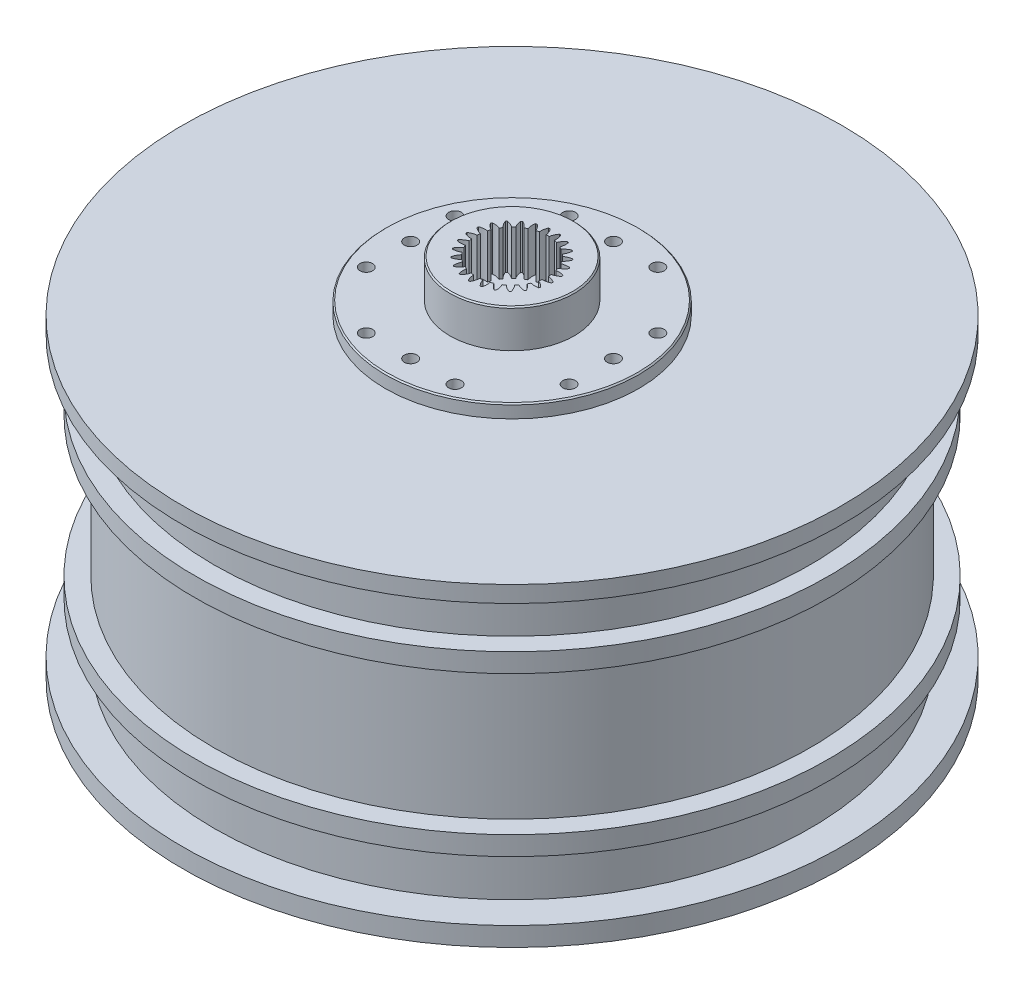
from build123d import *

# Parameters (mm, degrees)
SKETCH_1_R               = 10
EXTRUDE_1_DEPTH          = 2
SKETCH_2_R               = 4.9
EXTRUDE_2_DEPTH          = 3
SKETCH_3_R               = 0.5
CUT_EXTRUDE_1_DEPTH      = 3
SKETCH_4_R               = 1.4
CUT_EXTRUDE_2_DEPTH      = 16
SKETCH_4_3_R             = 4.35
SKETCH_4_3_R_2           = 2.9
CUT_EXTRUDE_3_DEPTH      = 0.45
SKETCH_4_4_R             = 2.9
SKETCH_4_4_R_2           = 1.4
CUT_EXTRUDE_4_DEPTH      = 0.95
CUT_EXTRUDE_5_DEPTH      = 3.5
CHAMFER_1_SIZE           = 0.1
EXTRUDE_4_DEPTH          = 2
PATTERN_CIRCULAR_1_COUNT = 5


with BuildPart() as part:
    # ｽｹｯﾁ1 → ﾎﾞｽ - 押し出し1 (new body)
    with BuildSketch(Plane(origin=(0, 0, 0), x_dir=(1, 0, 0), z_dir=(0, 1, 0))):
        Circle(SKETCH_1_R)
    extrude(amount=EXTRUDE_1_DEPTH)

    # ｽｹｯﾁ2 → ﾎﾞｽ - 押し出し2 (add)
    with BuildSketch(Plane(origin=(0, 2, 0), x_dir=(1, 0, 0), z_dir=(0, 1, 0))):
        Circle(SKETCH_2_R)
    extrude(amount=EXTRUDE_2_DEPTH)

    # ｽｹｯﾁ3 → ｶｯﾄ - 押し出し1 (cut)
    with BuildSketch(Plane.XZ):
        with Locations((-3.5, 8)):
            Circle(SKETCH_3_R)
        with Locations((0, 8)):
            Circle(SKETCH_3_R)
        with Locations((3.5, 8)):
            Circle(SKETCH_3_R)
        with Locations((8, 0)):
            Circle(SKETCH_3_R)
        with Locations((8, 3.5)):
            Circle(SKETCH_3_R)
        with Locations((8, -3.5)):
            Circle(SKETCH_3_R)
        with Locations((0, -8)):
            Circle(SKETCH_3_R)
        with Locations((3.5, -8)):
            Circle(SKETCH_3_R)
        with Locations((-3.5, -8)):
            Circle(SKETCH_3_R)
        with Locations((-8, 0)):
            Circle(SKETCH_3_R)
        with Locations((-8, -3.5)):
            Circle(SKETCH_3_R)
        with Locations((-8, 3.5)):
            Circle(SKETCH_3_R)
    extrude(amount=-CUT_EXTRUDE_1_DEPTH, mode=Mode.SUBTRACT)

    # ｽｹｯﾁ4 → ｶｯﾄ - 押し出し2 (cut, through all)
    with BuildSketch(Plane.XZ):
        Circle(SKETCH_4_R)
    extrude(amount=-CUT_EXTRUDE_2_DEPTH, mode=Mode.SUBTRACT)

    # ｽｹｯﾁ4<3> → ｶｯﾄ - 押し出し3 (cut)
    with BuildSketch(Plane.XZ):
        Circle(SKETCH_4_3_R)
        Circle(SKETCH_4_3_R_2, mode=Mode.SUBTRACT)
    extrude(amount=-CUT_EXTRUDE_3_DEPTH, mode=Mode.SUBTRACT)

    # ｽｹｯﾁ4<4> → ｶｯﾄ - 押し出し4 (cut)
    with BuildSketch(Plane.XZ):
        Circle(SKETCH_4_4_R)
        Circle(SKETCH_4_4_R_2, mode=Mode.SUBTRACT)
    extrude(amount=-CUT_EXTRUDE_4_DEPTH, mode=Mode.SUBTRACT)

    # ｽｹｯﾁ6 → ｶｯﾄ - 押し出し5 (cut)
    with BuildSketch(Plane(origin=(0, 5, 0), x_dir=(1, 0, 0), z_dir=(0, 1, 0))):
        with BuildLine():
            ThreePointArc((0.812423428, 2.691560964), (0.699191618, 2.723171558), (0.584737306, 2.750020824))
            ThreePointArc((0.584737306, 2.750020824), (0.573104806, 3.064374634), (0.483360636, 3.365870267))
            ThreePointArc((0.483360636, 3.365870267), (0.426183127, 3.37358683), (0.368882924, 3.380332165))
            ThreePointArc((0.368882924, 3.380332165), (0.206979317, 3.11062704), (0.11753566, 2.809042118))
            ThreePointArc((0.11753566, 2.809042118), (0, 2.8115), (-0.11753566, 2.809042118))
            ThreePointArc((-0.11753566, 2.809042118), (-0.206979317, 3.11062704), (-0.368882924, 3.380332165))
            ThreePointArc((-0.368882924, 3.380332165), (-0.426183127, 3.37358683), (-0.483360636, 3.365870267))
            ThreePointArc((-0.483360636, 3.365870267), (-0.573104806, 3.064374634), (-0.584737306, 2.750020824))
            ThreePointArc((-0.584737306, 2.750020824), (-0.699191618, 2.723171558), (-0.812423428, 2.691560964))
            ThreePointArc((-0.812423428, 2.691560964), (-0.974058169, 2.961427308), (-1.197948213, 3.182395362))
            ThreePointArc((-1.197948213, 3.182395362), (-1.251770729, 3.161611963), (-1.30523287, 3.139918361))
            ThreePointArc((-1.30523287, 3.139918361), (-1.317178647, 2.8255763), (-1.250269077, 2.518205608))
            ThreePointArc((-1.250269077, 2.518205608), (-1.354450455, 2.463736231), (-1.456263645, 2.404959136))
            ThreePointArc((-1.456263645, 2.404959136), (-1.679933363, 2.626150207), (-1.951742011, 2.784496953))
            ThreePointArc((-1.951742011, 2.784496953), (-1.998704972, 2.750981388), (-2.045092522, 2.716673837))
            ThreePointArc((-2.045092522, 2.716673837), (-1.978489309, 2.409236616), (-1.837241843, 2.128162273))
            ThreePointArc((-1.837241843, 2.128162273), (-1.924604188, 2.049495296), (-2.008601461, 1.967244881))
            ThreePointArc((-2.008601461, 1.967244881), (-2.280252166, 2.125862431), (-2.58290068, 2.211638361))
            ThreePointArc((-2.58290068, 2.211638361), (-2.620053231, 2.167496535), (-2.65645149, 2.122730704))
            ThreePointArc((-2.65645149, 2.122730704), (-2.515484211, 1.841515734), (-2.308773948, 1.604398675))
            ThreePointArc((-2.308773948, 1.604398675), (-2.373827963, 1.506477034), (-2.43473146, 1.405921395))
            ThreePointArc((-2.43473146, 1.405921395), (-2.737294339, 1.4919989), (-3.051766199, 1.499814396))
            ThreePointArc((-3.051766199, 1.499814396), (-3.076773909, 1.447819903), (-3.100895841, 1.395408594))
            ThreePointArc((-3.100895841, 1.395408594), (-2.894421989, 1.158085646), (-2.635237294, 0.979824808))
            ThreePointArc((-2.635237294, 0.979824808), (-2.673895396, 0.86880128), (-2.707878327, 0.756258697))
            ThreePointArc((-2.707878327, 0.756258697), (-3.022342242, 0.76438759), (-3.328878026, 0.693751577))
            ThreePointArc((-3.328878026, 0.693751577), (-3.340169567, 0.637171422), (-3.350499502, 0.58040783))
            ThreePointArc((-3.350499502, 0.58040783), (-3.091492589, 0.401888778), (-2.79611899, 0.293684944))
            ThreePointArc((-2.79611899, 0.293684944), (-2.805952147, 0.176535546), (-2.81087924, 0.059077484))
            ThreePointArc((-2.81087924, 0.059077484), (-3.117485266, -0.011253003), (-3.396824202, -0.155902205))
            ThreePointArc((-3.396824202, -0.155902205), (-3.393690087, -0.213512883), (-3.389578957, -0.271062092))
            ThreePointArc((-3.389578957, -0.271062092), (-3.094313339, -0.37956024), (-2.781310245, -0.410908224))
            ThreePointArc((-2.781310245, -0.410908224), (-2.761700605, -0.526822566), (-2.737262272, -0.641815785))
            ThreePointArc((-2.737262272, -0.641815785), (-3.016745226, -0.786186528), (-3.251335422, -0.995760078))
            ThreePointArc((-3.251335422, -0.995760078), (-3.233972578, -1.050781388), (-3.2156787, -1.105500186))
            ThreePointArc((-3.2156787, -1.105500186), (-2.902707002, -1.137160092), (-2.59174155, -1.089682518))
            ThreePointArc((-2.59174155, -1.089682518), (-2.543921258, -1.197078478), (-2.49165305, -1.302381408))
            ThreePointArc((-2.49165305, -1.302381408), (-2.726451989, -1.511721062), (-2.90155328, -1.773050683))
            ThreePointArc((-2.90155328, -1.773050683), (-2.871052678, -1.822025434), (-2.839725523, -1.870475638))
            ThreePointArc((-2.839725523, -1.870475638), (-2.528712909, -1.823307993), (-2.2393242, -1.699988052))
            ThreePointArc((-2.2393242, -1.699988052), (-2.166297982, -1.792117547), (-2.089484102, -1.881113616))
            ThreePointArc((-2.089484102, -1.881113616), (-2.264845745, -2.142268603), (-2.369455873, -2.438933993))
            ThreePointArc((-2.369455873, -2.438933993), (-2.327733979, -2.478784921), (-2.285341949, -2.517922226))
            ThreePointArc((-2.285341949, -2.517922226), (-1.995830484, -2.394890748), (-1.746201876, -2.203477084))
            ThreePointArc((-1.746201876, -2.203477084), (-1.652558237, -2.27455128), (-1.556025183, -2.341648539))
            ThreePointArc((-1.556025183, -2.341648539), (-1.660930914, -2.638209528), (-1.68847684, -2.951570111))
            ThreePointArc((-1.68847684, -2.951570111), (-1.638155193, -2.979793235), (-1.587361935, -3.007158501))
            ThreePointArc((-1.587361935, -3.007158501), (-1.337542689, -2.815993709), (-1.143359266, -2.568513547))
            ThreePointArc((-1.143359266, -2.568513547), (-1.03498218, -2.61406659), (-0.92479548, -2.655049071))
            ThreePointArc((-0.92479548, -2.655049071), (-0.952653686, -2.968382046), (-0.901404598, -3.278748223))
            ThreePointArc((-0.901404598, -3.278748223), (-0.845645092, -3.293570181), (-0.789642133, -3.307443947))
            ThreePointArc((-0.789642133, -3.307443947), (-0.595212168, -3.060157429), (-0.468675188, -2.772160857))
            ThreePointArc((-0.468675188, -2.772160857), (-0.352374386, -2.789330483), (-0.235457476, -2.801623106))
            ThreePointArc((-0.235457476, -2.801623106), (-0.184517722, -3.112040203), (-0.057693789, -3.399910526))
            ThreePointArc((-0.057693789, -3.399910526), (0, -3.4004), (0.057693789, -3.399910526))
            ThreePointArc((0.057693789, -3.399910526), (0.184517722, -3.112040203), (0.235457476, -2.801623106))
            ThreePointArc((0.235457476, -2.801623106), (0.352374386, -2.789330483), (0.468675188, -2.772160857))
            ThreePointArc((0.468675188, -2.772160857), (0.595212168, -3.060157429), (0.789642133, -3.307443947))
            ThreePointArc((0.789642133, -3.307443947), (0.845645092, -3.293570181), (0.901404598, -3.278748223))
            ThreePointArc((0.901404598, -3.278748223), (0.952653686, -2.968382046), (0.92479548, -2.655049071))
            ThreePointArc((0.92479548, -2.655049071), (1.03498218, -2.61406659), (1.143359266, -2.568513547))
            ThreePointArc((1.143359266, -2.568513547), (1.337542689, -2.815993709), (1.587361935, -3.007158501))
            ThreePointArc((1.587361935, -3.007158501), (1.638155193, -2.979793235), (1.68847684, -2.951570111))
            ThreePointArc((1.68847684, -2.951570111), (1.660930914, -2.638209528), (1.556025183, -2.341648539))
            ThreePointArc((1.556025183, -2.341648539), (1.652558237, -2.27455128), (1.746201876, -2.203477084))
            ThreePointArc((1.746201876, -2.203477084), (1.995830484, -2.394890748), (2.285341949, -2.517922226))
            ThreePointArc((2.285341949, -2.517922226), (2.327733979, -2.478784921), (2.369455873, -2.438933993))
            ThreePointArc((2.369455873, -2.438933993), (2.264845745, -2.142268603), (2.089484102, -1.881113616))
            ThreePointArc((2.089484102, -1.881113616), (2.166297982, -1.792117547), (2.2393242, -1.699988052))
            ThreePointArc((2.2393242, -1.699988052), (2.528712909, -1.823307993), (2.839725523, -1.870475638))
            ThreePointArc((2.839725523, -1.870475638), (2.871052678, -1.822025434), (2.90155328, -1.773050683))
            ThreePointArc((2.90155328, -1.773050683), (2.726451989, -1.511721062), (2.49165305, -1.302381408))
            ThreePointArc((2.49165305, -1.302381408), (2.543921258, -1.197078478), (2.59174155, -1.089682518))
            ThreePointArc((2.59174155, -1.089682518), (2.902707002, -1.137160092), (3.2156787, -1.105500186))
            ThreePointArc((3.2156787, -1.105500186), (3.233972578, -1.050781388), (3.251335422, -0.995760078))
            ThreePointArc((3.251335422, -0.995760078), (3.016745226, -0.786186528), (2.737262272, -0.641815785))
            ThreePointArc((2.737262272, -0.641815785), (2.761700605, -0.526822566), (2.781310245, -0.410908224))
            ThreePointArc((2.781310245, -0.410908224), (3.094313339, -0.37956024), (3.389578957, -0.271062092))
            ThreePointArc((3.389578957, -0.271062092), (3.393690087, -0.213512883), (3.396824202, -0.155902205))
            ThreePointArc((3.396824202, -0.155902205), (3.117485266, -0.011253003), (2.81087924, 0.059077484))
            ThreePointArc((2.81087924, 0.059077484), (2.805952147, 0.176535546), (2.79611899, 0.293684944))
            ThreePointArc((2.79611899, 0.293684944), (3.091492589, 0.401888778), (3.350499502, 0.58040783))
            ThreePointArc((3.350499502, 0.58040783), (3.340169567, 0.637171422), (3.328878026, 0.693751577))
            ThreePointArc((3.328878026, 0.693751577), (3.022342242, 0.76438759), (2.707878327, 0.756258697))
            ThreePointArc((2.707878327, 0.756258697), (2.673895396, 0.86880128), (2.635237294, 0.979824808))
            ThreePointArc((2.635237294, 0.979824808), (2.894421989, 1.158085646), (3.100895841, 1.395408594))
            ThreePointArc((3.100895841, 1.395408594), (3.076773909, 1.447819903), (3.051766199, 1.499814396))
            ThreePointArc((3.051766199, 1.499814396), (2.737294339, 1.4919989), (2.43473146, 1.405921395))
            ThreePointArc((2.43473146, 1.405921395), (2.373827963, 1.506477034), (2.308773948, 1.604398675))
            ThreePointArc((2.308773948, 1.604398675), (2.515484211, 1.841515734), (2.65645149, 2.122730704))
            ThreePointArc((2.65645149, 2.122730704), (2.620053231, 2.167496535), (2.58290068, 2.211638361))
            ThreePointArc((2.58290068, 2.211638361), (2.280252166, 2.125862431), (2.008601461, 1.967244881))
            ThreePointArc((2.008601461, 1.967244881), (1.924604188, 2.049495296), (1.837241843, 2.128162273))
            ThreePointArc((1.837241843, 2.128162273), (1.978489309, 2.409236616), (2.045092522, 2.716673837))
            ThreePointArc((2.045092522, 2.716673837), (1.998704972, 2.750981388), (1.951742011, 2.784496953))
            ThreePointArc((1.951742011, 2.784496953), (1.679933363, 2.626150207), (1.456263645, 2.404959136))
            ThreePointArc((1.456263645, 2.404959136), (1.354450455, 2.463736231), (1.250269077, 2.518205608))
            ThreePointArc((1.250269077, 2.518205608), (1.317178647, 2.8255763), (1.30523287, 3.139918361))
            ThreePointArc((1.30523287, 3.139918361), (1.251770729, 3.161611963), (1.197948213, 3.182395362))
            ThreePointArc((1.197948213, 3.182395362), (0.974058169, 2.961427308), (0.812423428, 2.691560964))
        make_face()
    extrude(amount=-CUT_EXTRUDE_5_DEPTH, mode=Mode.SUBTRACT)

    # 面取り1
    chamfer_1_edges = [part.edges().sort_by_distance(p)[0] for p in [
        (-10, 0, 0),
        (-10, 2, 0),
        (-4.9, 5, 0),
    ]]
    chamfer(chamfer_1_edges, length=CHAMFER_1_SIZE)

    # ｽｹｯﾁ11 → 回転1 (revolve)
    with BuildSketch(Plane.XY):
        Polygon((18.5, -4.05), (18.5, -23.85), (23.5, -23.85), (26, -23.85), (26, -22.35), (23.5, -22.35), (23.5, -18.35), (25, -18.35), (25, -16.85), (23.5, -16.85), (23.5, -5.85), (25, -5.85), (25, -4.35), (23.5, -4.35), (23.5, -0.35), (26, -0.35), (26, 0.95), (23.5, 0.95), (2.9, 0.95), (2.9, -0.35), (2.9, -4.05), align=None)
    revolve(axis=Axis((0, 0, 0), (0, 1, 0)))

    # ｽｹｯﾁ14 → ﾎﾞｽ - 押し出し4 (add, symmetric)
    with BuildSketch(Plane.XY):
        Polygon((-20.088651158, -3.122196197), (-20.088651158, -16.878706543), (-10.335790307, -3.122196197), align=None)
    extrude_4 = extrude(amount=EXTRUDE_4_DEPTH, both=True)

    # 円形ﾊﾟﾀｰﾝ1: ﾎﾞｽ - 押し出し4 ×5 about axis
    pattern_circular_1_axis = Axis((0, 0, 0), (0, 1, 0))
    for i in range(1, PATTERN_CIRCULAR_1_COUNT):
        add(extrude_4.rotate(pattern_circular_1_axis, i * 360 / PATTERN_CIRCULAR_1_COUNT))


solid = part.part
